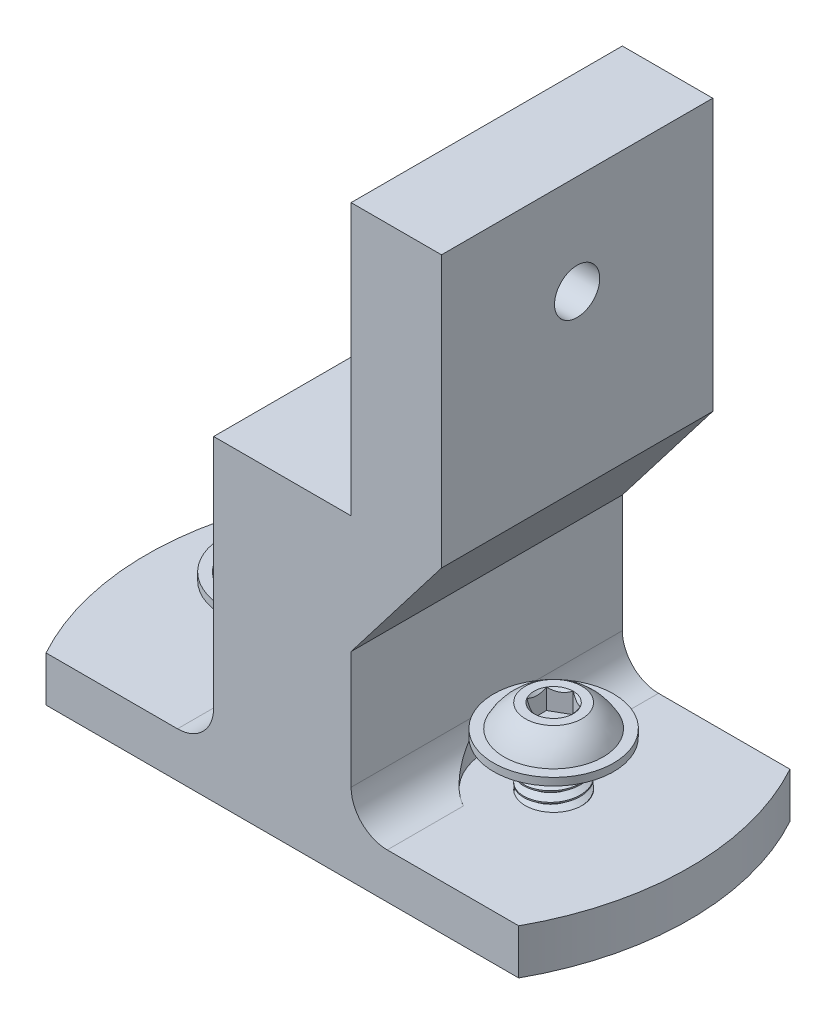
from build123d import *

# Parameters (mm, degrees)
SKETCH1_R           = 3.96875
BOSS_EXTRUDE1_DEPTH = 17.4625
CUT_SWEEP1_PITCH    = 1.411111111
SKETCH4_OUTSIDE_W   = 16.912
SKETCH4_OUTSIDE_H   = 16.912
SKETCH4_OUTSIDE_R   = 2.899449189
CUT_EXTRUDE1_DEPTH  = 1.411111111
CUT_EXTRUDE1_DRAFT  = -45
CUT_EXTRUDE2_DEPTH  = 2.8575
BOSS_EXTRUDE2_START = -6.35
SKETCH8_R           = 3.96875
BOSS_EXTRUDE2_DEPTH = 6.35
BOSS_EXTRUDE7_DEPTH = 38.1
SKETCH16_R          = 3.175
CUT_EXTRUDE5_DEPTH  = 66.087500076
CUT_EXTRUDE6_DEPTH  = 8.89
FILLET1_R           = 5.08
SKETCH20_R          = 9.398
CUT_EXTRUDE7_DEPTH  = 12.7
BOSS_EXTRUDE8_DEPTH = 38.1
SKETCH22_R          = 3.175
CUT_EXTRUDE8_DEPTH  = 38.1


with BuildPart() as part:
    # Sketch1 → Boss-Extrude1 (new body)
    with BuildSketch(Plane(origin=(0, 0, 0), x_dir=(1, 0, 0), z_dir=(0, 1, 0))):
        with Locations(Location((-19.05, 0, 0), (0, 0, 270))):
            Circle(SKETCH1_R)
    extrude(amount=-BOSS_EXTRUDE1_DEPTH)

    # Cut-Sweep1: the profile of Sketch3 screwed along a right-hand helix of 13.375 turns, 8 arcs to a turn; built about Z, then put on its axis
    cut_sweep1_z = Axis((0, 0, 0), (0, 0, 1))
    cut_sweep1_corners = [(3.052206448, 0, -0.529166667), (4.045128629, 0, 0.044097222), (4.045128629, 0, -1.278819444), (3.052206448, 0, -0.705555556)]
    with BuildLine(mode=Mode.PRIVATE) as cut_sweep1_profile:
        Line(cut_sweep1_corners[0], cut_sweep1_corners[1])
        Line(cut_sweep1_corners[1], cut_sweep1_corners[2])
        Line(cut_sweep1_corners[2], cut_sweep1_corners[3])
        Line(cut_sweep1_corners[3], cut_sweep1_corners[0])
    cut_sweep1_cap = Face(cut_sweep1_profile.wire())
    cut_sweep1_turn_angles = [0, 22.5, 45, 67.5, 90, 112.5, 135, 157.5, 180, 202.5, 225, 247.5, 270, 292.5, 315, 337.5, 360]
    cut_sweep1_turn_weights = [1, 0.9238795325112867, 1, 0.9238795325112867, 1, 0.9238795325112867, 1, 0.9238795325112867, 1, 0.9238795325112867, 1, 0.9238795325112867, 1, 0.9238795325112867, 1, 0.9238795325112867, 1]
    cut_sweep1_turn_rails = [Edge.make_bspline([Vector(p[0], p[1], 0).rotate(cut_sweep1_z, cut_sweep1_turn_angles[k]) / cut_sweep1_turn_weights[k] + Vector(0, 0, p[2] + CUT_SWEEP1_PITCH * cut_sweep1_turn_angles[k] / 360) for k in range(17)], [0, 0, 0, 1, 1, 2, 2, 3, 3, 4, 4, 5, 5, 6, 6, 7, 7, 8, 8, 8], 2, cut_sweep1_turn_weights) for p in cut_sweep1_corners]
    cut_sweep1_turn_sides = [Face.make_surface_from_curves(cut_sweep1_turn_rails[p[0]], cut_sweep1_turn_rails[p[1]]) for p in [(0, 1), (1, 2), (2, 3), (3, 0)]]
    cut_sweep1_last_angles = [4680, 4702.5, 4725, 4747.5, 4770, 4792.5, 4815]
    cut_sweep1_last_weights = [1, 0.9238795325112867, 1, 0.9238795325112867, 1, 0.9238795325112594, 1]
    cut_sweep1_last_rails = [Edge.make_bspline([Vector(p[0], p[1], 0).rotate(cut_sweep1_z, cut_sweep1_last_angles[k]) / cut_sweep1_last_weights[k] + Vector(0, 0, p[2] + CUT_SWEEP1_PITCH * cut_sweep1_last_angles[k] / 360) for k in range(7)], [0, 0, 0, 1, 1, 2, 2, 3, 3, 3], 2, cut_sweep1_last_weights) for p in cut_sweep1_corners]
    cut_sweep1_last_sides = [Face.make_surface_from_curves(cut_sweep1_last_rails[p[0]], cut_sweep1_last_rails[p[1]]) for p in [(0, 1), (1, 2), (2, 3), (3, 0)]]
    cut_sweep1 = Plane(origin=(-19.05, -17.4625, 0), x_dir=(0, 0, -1), z_dir=(0, 1, 0)) * Solid(Shell([*[p.moved(Location((0, 0, CUT_SWEEP1_PITCH * i))) for i in range(13) for p in cut_sweep1_turn_sides], *cut_sweep1_last_sides, cut_sweep1_cap, cut_sweep1_cap.rotate(cut_sweep1_z, 4815).moved(Location((0, 0, CUT_SWEEP1_PITCH * 4815 / 360)))]))
    add(cut_sweep1, mode=Mode.SUBTRACT)


with BuildPart() as cut_extrude1_tool:
    # Sketch4 outside → Cut-Extrude1 (with draft: the straight prism first)
    with BuildSketch(Plane.XZ.offset(17.4625)):
        with Locations((-19.05, 0)):
            Rectangle(SKETCH4_OUTSIDE_W, SKETCH4_OUTSIDE_H)
        with Locations((-19.05, 0)):
            Circle(SKETCH4_OUTSIDE_R, mode=Mode.SUBTRACT)
    extrude(amount=-CUT_EXTRUDE1_DEPTH)
    # Cut-Extrude1: the draft: its side faces are tilted about the plane it starts from
    cut_extrude1_sides = [cut_extrude1_tool.faces().sort_by_distance(p)[0] for p in [
        (-19.05, -16.756944444, -8.456),
        (-10.594, -16.756944444, 0),
        (-19.05, -16.756944444, 8.456),
        (-27.506, -16.756944444, 0),
        (-21.949449189, -16.756944444, 0),
    ]]
    draft(cut_extrude1_sides, Plane.XZ.offset(17.4625), CUT_EXTRUDE1_DRAFT)


with BuildPart() as part_1:
    add(part.part)

    # Cut-Extrude1: cut by cut_extrude1_tool
    add(cut_extrude1_tool.part, mode=Mode.SUBTRACT)

    # Sketch5 → Revolve1 (revolve)
    with BuildSketch(Plane.XY, mode=Mode.PRIVATE) as revolve1_sk:
        with BuildLine():
            Line((-19.05, 0), (-19.05, 4.2164))
            Line((-19.05, 4.2164), (-23.01875, 4.2164))
            ThreePointArc((-23.01875, 4.2164), (-24.732243312, 2.846599775), (-25.9969, 1.0541))
            Line((-25.9969, 1.0541), (-27.4701, 1.0541))
            Line((-27.4701, 1.0541), (-27.4701, 0))
            Line((-27.4701, 0), (-19.05, 0))
        make_face()
    revolve(revolve1_sk.sketch.rotate(Axis((-19.05, 0, 0), (0, 1, 0)), 270), axis=Axis((-19.05, 0, 0), (0, 1, 0)))

    # Sketch6 → Cut-Extrude2 (cut)
    with BuildSketch(Plane(origin=(0, 4.2164, 0), x_dir=(1, 0, 0), z_dir=(0, 1, 0))):
        Polygon((-19.05, 2.749630657), (-21.43125, 1.374815329), (-21.43125, -1.374815329), (-19.05, -2.749630657), (-16.66875, -1.374815329), (-16.66875, 1.374815329), align=None)
    extrude(amount=-CUT_EXTRUDE2_DEPTH, mode=Mode.SUBTRACT)

    # Cut-Extrude3 cone 1 section (through the dimple's axis) → Cut-Extrude3 (revolve, cut)
    with BuildSketch(Plane(origin=(-19.05, 4.2164, 0), x_dir=(0, 0, 1), z_dir=(1, 0, 0))):
        Polygon((0, 0), (2.749630657, 0), (0, 2.749630657), align=None)
    revolve(axis=Axis((-19.05, 4.2164, 0), (0, -1, 0)), mode=Mode.SUBTRACT)


with BuildPart() as body_2:
    # Body-Move/Copy1: copy of part
    add(part_1.part.moved(Location((38.1, 0, 0))))


with BuildPart() as body_3:
    # Sketch8 → Boss-Extrude2 (new body)
    with BuildSketch(Plane(origin=(0, 0, 0), x_dir=(1, 0, 0), z_dir=(0, 1, 0)).offset(BOSS_EXTRUDE2_START)):
        with BuildLine():
            Line((-33.19559728, 19.05), (33.19559728, 19.05))
            ThreePointArc((33.19559728, 19.05), (38.1, 0), (33.19559728, -19.05))
            Line((33.19559728, -19.05), (-33.19559728, -19.05))
            ThreePointArc((-33.19559728, -19.05), (-38.1, 0), (-33.19559728, 19.05))
        make_face()
        with Locations(Location((19.05, 0, 0), (0, 0, 270))):
            Circle(SKETCH8_R, mode=Mode.SUBTRACT)
        with Locations(Location((-19.05, 0, 0), (0, 0, 270))):
            Circle(SKETCH8_R, mode=Mode.SUBTRACT)
    extrude(amount=-BOSS_EXTRUDE2_DEPTH)

    # Sketch15 → Boss-Extrude7 (add)
    with BuildSketch(Plane(origin=(0, -6.35, 0), x_dir=(1, 0, 0), z_dir=(0, 1, 0))):
        Polygon((0, 19.05), (-9.652, 19.05), (-9.652, -19.05), (9.652, -19.05), (9.652, 19.05), align=None)
    extrude(amount=BOSS_EXTRUDE7_DEPTH)

    # Sketch16 → Cut-Extrude5 (cut, through all)
    with BuildSketch(Plane(origin=(0, 31.75, 0), x_dir=(1, 0, 0), z_dir=(0, 1, 0))):
        with Locations(Location((0, 0, 0), (0, 0, 270))):
            Circle(SKETCH16_R)
    extrude(amount=-CUT_EXTRUDE5_DEPTH, mode=Mode.SUBTRACT)

    # Sketch19 → Cut-Extrude6 (cut)
    with BuildSketch(Plane.XZ.offset(12.7)):
        Polygon((0, 6.604), (-5.719231767, 3.302), (-5.719231767, -3.302), (0, -6.604), (5.719231767, -3.302), (5.719231767, 3.302), align=None)
    extrude(amount=-CUT_EXTRUDE6_DEPTH, mode=Mode.SUBTRACT)

    # Fillet1
    fillet1_edges = [body_3.edges().sort_by_distance(p)[0] for p in [
        (-9.652, -6.35, 0),
        (9.652, -6.35, 0),
    ]]
    fillet(fillet1_edges, radius=FILLET1_R)

    # Sketch20 → Cut-Extrude7 (cut)
    with BuildSketch(Plane(origin=(0, -6.35, 0), x_dir=(1, 0, 0), z_dir=(0, 1, 0))):
        with Locations((19.05, 0)):
            Circle(SKETCH20_R)
        with Locations((-19.05, 0)):
            Circle(SKETCH20_R)
    extrude(amount=CUT_EXTRUDE7_DEPTH, mode=Mode.SUBTRACT)

    # Sketch21 → Boss-Extrude8 (add)
    with BuildSketch(Plane.XY.offset(19.05)):
        Polygon((9.652, 15.24), (22.352, 31.75), (22.352, 69.85), (9.652, 69.85), (9.652, 31.75), align=None)
    extrude(amount=-BOSS_EXTRUDE8_DEPTH)

    # Sketch22 → Cut-Extrude8 (cut)
    with BuildSketch(Plane.ZY.offset(-9.652)):
        with Locations((0, 55.88)):
            Circle(SKETCH22_R)
    extrude(amount=-CUT_EXTRUDE8_DEPTH, mode=Mode.SUBTRACT)


solid = Compound([part_1.part, body_2.part, body_3.part])
